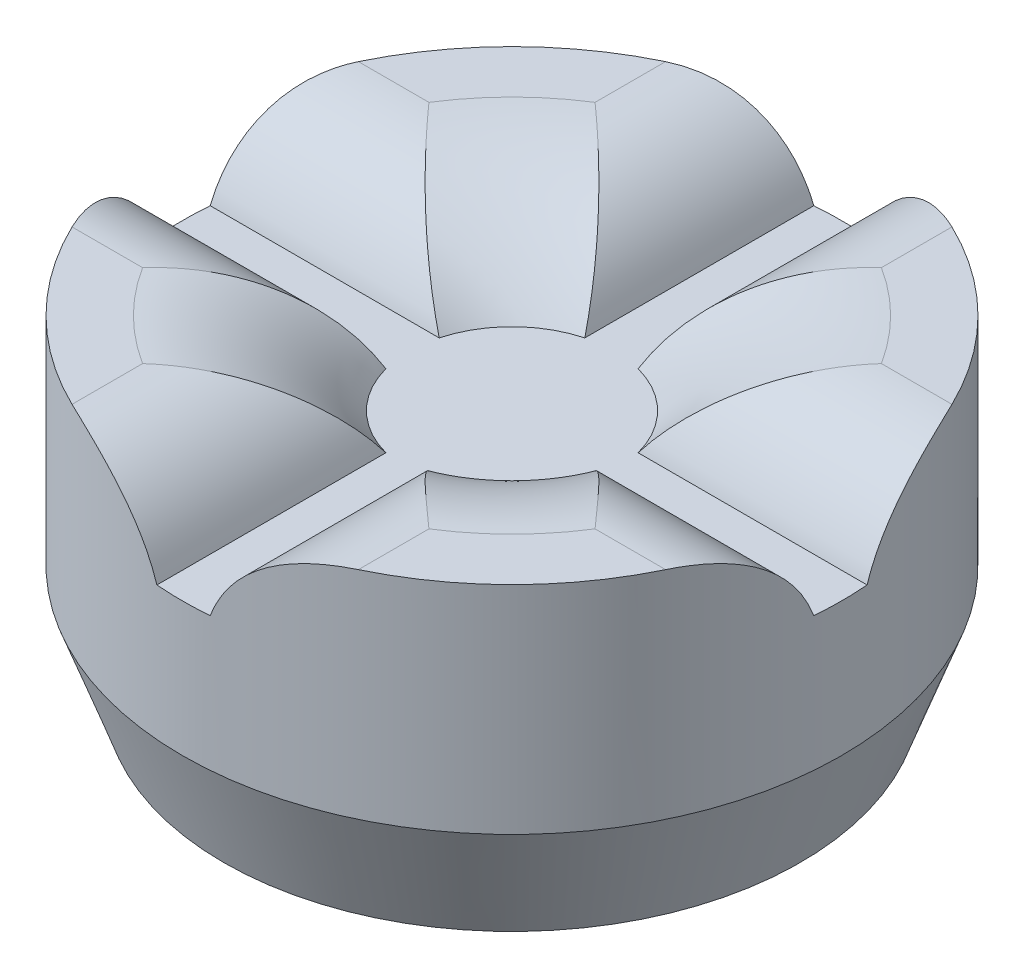
from build123d import *

# Parameters (mm, degrees)
SKETCH3_R           = 8
BOSS_EXTRUDE3_DEPTH = 8
CUT_EXTRUDE2_DEPTH  = 2
CUT_EXTRUDE2_DRAFT  = -10
SKETCH7_R           = 2.5
CUT_EXTRUDE4_DEPTH  = 2
FILLET1_R           = 5
FILLET2_START       = -9
FILLET2_DEPTH       = 18
FILLET2_2_DEPTH     = 18
CUT_EXTRUDE5_DEPTH  = 2.2
CHAMFER2_SIZE       = 0.2
CHAMFER2_SIZE2      = 0.346410162
CHAMFER3_SIZE       = 1
CHAMFER3_SIZE2      = 2.747477419


with BuildPart() as part:
    # Sketch3 → Boss-Extrude3 (new body)
    with BuildSketch(Plane(origin=(0, 0, 0), x_dir=(1, 0, 0), z_dir=(0, 1, 0))):
        with Locations(Location((0, 0, 0), (0, 0, 270))):
            Circle(SKETCH3_R)
    extrude(amount=BOSS_EXTRUDE3_DEPTH)


with BuildPart() as cut_extrude2_tool:
    # Sketch4 → Cut-Extrude2 (with draft: the straight prism first)
    with BuildSketch(Plane(origin=(0, 8, 0), x_dir=(1, 0, 0), z_dir=(0, 1, 0))):
        Polygon((-9, -1), (-1, -1), (-1, -9), (1, -9), (1, -1), (9, -1), (9, 1), (1, 1), (1, 9), (-1, 9), (-1, 1), (-9, 1), align=None)
    extrude(amount=-CUT_EXTRUDE2_DEPTH)
    # Cut-Extrude2: the draft: its side faces are tilted about the plane it starts from
    cut_extrude2_sides = [cut_extrude2_tool.faces().sort_by_distance(p)[0] for p in [
        (-5, 7, 1),
        (-1, 7, 5),
        (0, 7, 9),
        (1, 7, 5),
        (5, 7, 1),
        (9, 7, 0),
        (5, 7, -1),
        (1, 7, -5),
        (0, 7, -9),
        (-1, 7, -5),
        (-5, 7, -1),
        (-9, 7, 0),
    ]]
    draft(cut_extrude2_sides, Plane(origin=(0, 8, 0), x_dir=(1, 0, 0), z_dir=(0, 1, 0)), CUT_EXTRUDE2_DRAFT)


with BuildPart() as part_1:
    add(part.part)

    # Cut-Extrude2: cut by cut_extrude2_tool
    add(cut_extrude2_tool.part, mode=Mode.SUBTRACT)

    # Sketch7 → Cut-Extrude4 (cut)
    with BuildSketch(Plane(origin=(0, 8, 0), x_dir=(1, 0, 0), z_dir=(0, 1, 0))):
        Circle(SKETCH7_R)
    extrude(amount=-CUT_EXTRUDE4_DEPTH, mode=Mode.SUBTRACT)

    # Fillet1
    # the kernel refuses this fillet: 5 mm, written as the material it takes off along each edge
    with BuildSketch(Plane(origin=(0, 8, 0), x_dir=(-0.7093247295722765, 0, -0.7048818539423588), z_dir=(0.7048818539423588, 0, -0.7093247295722765))) as fillet1_piece_1:
        with BuildLine():
            CenterArc((6.5, -5), FILLET1_R, 90, 53.130102354)
            Line((2.5, -2), (2.42, -1.94))
            ThreePointArc((2.42, -1.94), (2.4, -1), (2.4, 0))
            Line((2.4, 0), (2.5, 0.1))
            Line((2.5, 0.1), (6.5, 0.1))
            Line((6.5, 0.1), (6.5, 0))
        make_face()
    revolve(axis=Axis((0, 8, 0), (0, 1, 0)), revolution_arc=359.64, mode=Mode.SUBTRACT)
    with BuildSketch(Plane(origin=(0, 8, 0), x_dir=(0.7048818539423484, 0, -0.7093247295722869), z_dir=(0.7093247295722869, 0, 0.7048818539423484))) as fillet1_piece_2:
        with BuildLine():
            CenterArc((6.5, -5), FILLET1_R, 90, 53.130102354)
            Line((2.5, -2), (2.42, -1.94))
            ThreePointArc((2.42, -1.94), (2.4, -1), (2.4, 0))
            Line((2.4, 0), (2.5, 0.1))
            Line((2.5, 0.1), (6.5, 0.1))
            Line((6.5, 0.1), (6.5, 0))
        make_face()
    revolve(axis=Axis((0, 8, 0), (0, 1, 0)), revolution_arc=359.64, mode=Mode.SUBTRACT)
    with BuildSketch(Plane(origin=(0, 8, 0), x_dir=(0.7093247295722607, 0, 0.7048818539423748), z_dir=(-0.7048818539423748, 0, 0.7093247295722607))) as fillet1_piece_3:
        with BuildLine():
            CenterArc((6.5, -5), FILLET1_R, 90, 53.130102354)
            Line((2.5, -2), (2.42, -1.94))
            ThreePointArc((2.42, -1.94), (2.4, -1), (2.4, 0))
            Line((2.4, 0), (2.5, 0.1))
            Line((2.5, 0.1), (6.5, 0.1))
            Line((6.5, 0.1), (6.5, 0))
        make_face()
    revolve(axis=Axis((0, 8, 0), (0, 1, 0)), revolution_arc=359.64, mode=Mode.SUBTRACT)
    with BuildSketch(Plane(origin=(0, 8, 0), x_dir=(-0.704881853942364, 0, 0.7093247295722713), z_dir=(-0.7093247295722713, 0, -0.704881853942364))) as fillet1_piece_4:
        with BuildLine():
            CenterArc((6.5, -5), FILLET1_R, 90, 53.130102354)
            Line((2.5, -2), (2.42, -1.94))
            ThreePointArc((2.42, -1.94), (2.4, -1), (2.4, 0))
            Line((2.4, 0), (2.5, 0.1))
            Line((2.5, 0.1), (6.5, 0.1))
            Line((6.5, 0.1), (6.5, 0))
        make_face()
    revolve(axis=Axis((0, 8, 0), (0, 1, 0)), revolution_arc=359.64, mode=Mode.SUBTRACT)

    # Fillet2: read off the stored shape, not the designer's step
    # Fillet2 outline → Fillet2 (cut)
    with BuildSketch(Plane.XY.offset(FILLET2_START)):
        with BuildLine():
            ThreePointArc((-3.475773163, 8), (-1.743722356, 7.449489743), (-0.647346039, 6))
            Line((-0.647346039, 6), (-1, 8))
            Line((-1, 8), (-3.475773163, 8))
        make_face()
        with BuildLine():
            Line((1, 8), (0.647346039, 6))
            ThreePointArc((0.647346039, 6), (1.743722356, 7.449489743), (3.475773163, 8))
            Line((3.475773163, 8), (1, 8))
        make_face()
    extrude(amount=FILLET2_DEPTH, mode=Mode.SUBTRACT)

    # Fillet2 2 outline → Fillet2 2 (cut)
    with BuildSketch(Plane.YZ.offset(FILLET2_START)):
        with BuildLine():
            ThreePointArc((8, 3.475773163), (7.449489743, 1.743722356), (6, 0.647346039))
            Line((6, 0.647346039), (8, 1))
            Line((8, 1), (8, 3.475773163))
        make_face()
        with BuildLine():
            Line((8, -1), (6, -0.647346039))
            ThreePointArc((6, -0.647346039), (7.449489743, -1.743722356), (8, -3.475773163))
            Line((8, -3.475773163), (8, -1))
        make_face()
    extrude(amount=FILLET2_2_DEPTH, mode=Mode.SUBTRACT)

    # Sketch5 → Cut-Extrude5 (cut)
    with BuildSketch(Plane.XZ):
        Polygon((1.414213562, 0), (0, -1.414213562), (-1.414213562, 0), (0, 1.414213562), align=None)
    extrude(amount=-CUT_EXTRUDE5_DEPTH, mode=Mode.SUBTRACT)

    # Chamfer2
    chamfer2_edges = [part_1.edges().sort_by_distance(p)[0] for p in [
        (0.7071067811865474, 0, 0.7071067811865479),
        (-0.7071067811865476, 0, 0.7071067811865477),
        (-0.7071067811865474, 0, -0.7071067811865474),
        (0.7071067811865477, 0, -0.7071067811865471),
    ]]
    chamfer2_side = [part_1.faces().sort_by_distance(p)[0] for p in [
        (0, 0, -7.77372583),
    ]]
    chamfer(chamfer2_edges, length=CHAMFER2_SIZE, length2=CHAMFER2_SIZE2, reference=chamfer2_side[0])

    # Chamfer3
    chamfer3_edges = [part_1.edges().sort_by_distance(p)[0] for p in [
        (0, 0, -8),
    ]]
    chamfer3_side = [part_1.faces().sort_by_distance(p)[0] for p in [
        (1.008528137, 0, 1.008528137),
    ]]
    chamfer(chamfer3_edges, length=CHAMFER3_SIZE, length2=CHAMFER3_SIZE2, reference=chamfer3_side[0])


solid = part_1.part
